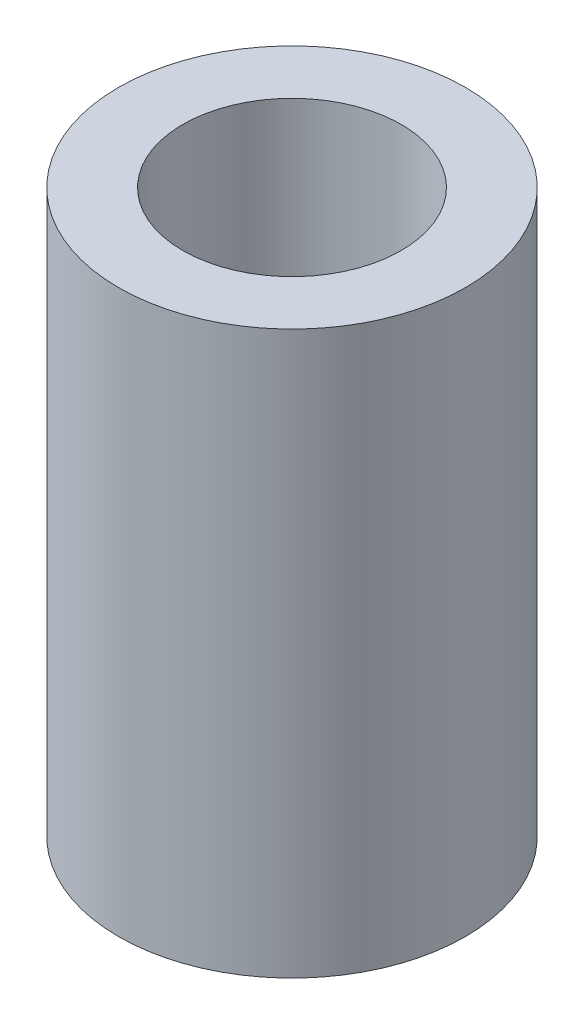
from build123d import *

# Parameters (mm, degrees)
SKETCH1_R           = 6.35
BOSS_EXTRUDE1_DEPTH = 20.58
SKETCH3_R           = 4
CUT_EXTRUDE2_DEPTH  = 23.453984056


with BuildPart() as part:
    # Sketch1 → Boss-Extrude1 (new body)
    with BuildSketch(Plane(origin=(0, 0, 0), x_dir=(1, 0, 0), z_dir=(0, 1, 0))):
        Circle(SKETCH1_R)
    extrude(amount=BOSS_EXTRUDE1_DEPTH)

    # Sketch3 → Cut-Extrude2 (cut, through all)
    with BuildSketch(Plane(origin=(0, 20.58, 0), x_dir=(1, 0, 0), z_dir=(0, 1, 0))):
        Circle(SKETCH3_R)
    extrude(amount=-CUT_EXTRUDE2_DEPTH, mode=Mode.SUBTRACT)


solid = part.part
